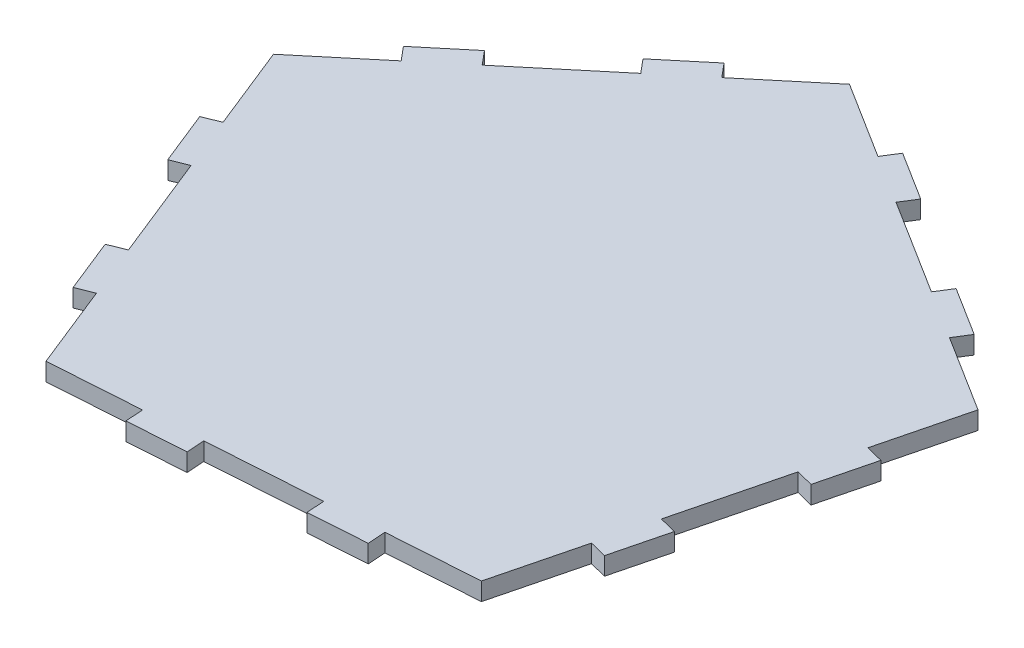
from build123d import *

# Parameters (mm, degrees)
BOSS_EXTRUDE1_DEPTH = 3.18
CUT_EXTRUDE2_DEPTH  = 10
CIRPATTERN2_COUNT   = 5


with BuildPart() as part:
    # Sketch1 → Boss-Extrude1 (new body)
    with BuildSketch(Plane(origin=(0, 0, 0), x_dir=(1, 0, 0), z_dir=(0, 1, 0))):
        Polygon((-63.737105075, 16.079573621), (-34.988431912, -55.6487276), (42.113064941, -50.472378708), (61.015737415, 24.455082065), (-4.403265369, 65.586450623), align=None)
    extrude(amount=BOSS_EXTRUDE1_DEPTH)

    # Sketch3 → Cut-Extrude2 (cut)
    with BuildSketch(Plane.XZ):
        Polygon((-53.933481975, -0.167099087), (-56.885223302, 1.015957604), (-63.737105075, -16.079573621), (-61.169762168, -18.221709207), align=None)
        Polygon((-53.083072553, 10.502371557), (-50.131331225, 9.319314866), (-42.690723106, 27.883725732), (-45.642464434, 29.066782423), align=None)
        Polygon((-34.988431912, 55.6487276), (-41.840313685, 38.553196376), (-38.888572357, 37.370139685), (-31.652292163, 55.424749805), align=None)
    cut_extrude2 = extrude(amount=-CUT_EXTRUDE2_DEPTH, mode=Mode.SUBTRACT)

    # CirPattern2: Cut-Extrude2 ×5 about axis
    cirpattern2_axis = Axis((0, 3.339, 0), (0, -1, 0))
    for i in range(1, CIRPATTERN2_COUNT):
        add(cut_extrude2.rotate(cirpattern2_axis, i * 360 / CIRPATTERN2_COUNT), mode=Mode.SUBTRACT)


solid = part.part
